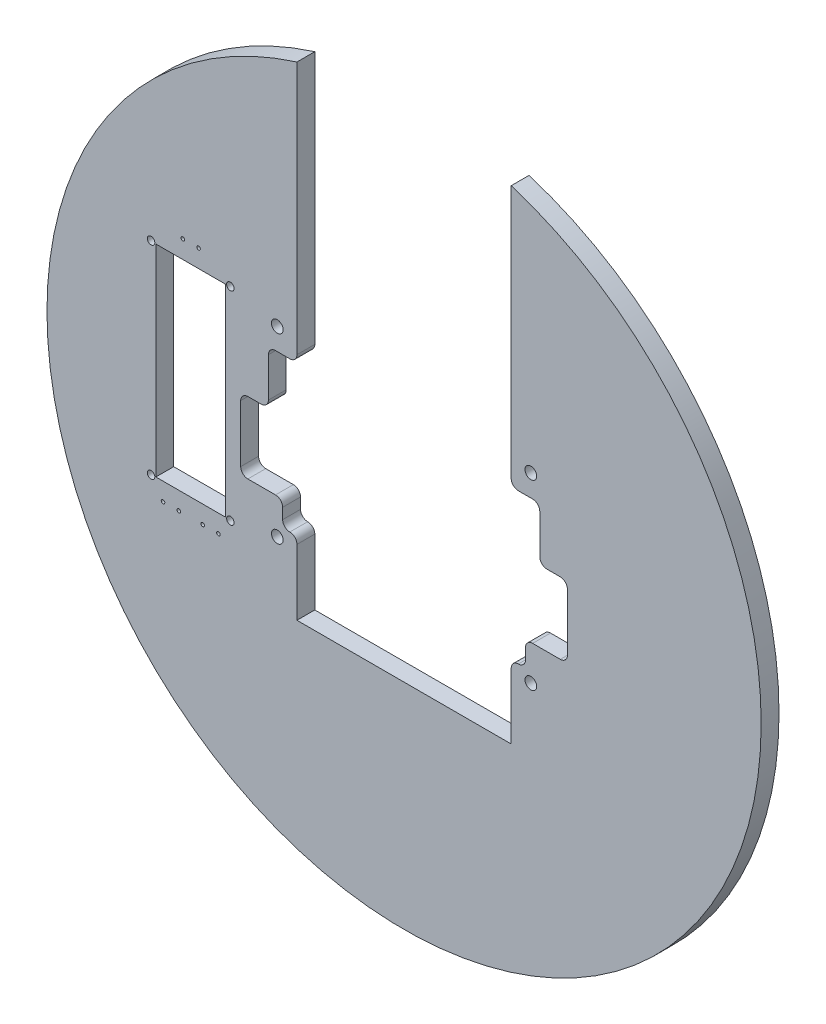
from build123d import *

# Parameters (mm, degrees)
BOSS_EXTRUDE1_DEPTH = 6.35
CUT_EXTRUDE1_REACH  = 210.789
SKETCH2_R           = 1.3335
SKETCH2_W           = 24.765
SKETCH2_H           = 71.755
CUT_EXTRUDE2_REACH  = 210.789
SKETCH3_R           = 0.635
CUT_EXTRUDE3_DEPTH  = 209.788828163
FILLET1_START       = -1
FILLET1_DEPTH       = 8
FILLET1_2_DEPTH     = 6.35
SKETCH5_R           = 2.0828
CUT_EXTRUDE4_DEPTH  = 209.788828163


with BuildPart() as part:
    # Sketch1 → Boss-Extrude1 (new body)
    with BuildSketch(Plane.XY):
        with BuildLine():
            Line((-38.1, 92.71), (-38.1, 165.60027858))
            ThreePointArc((-38.1, 165.60027858), (0, -82.55), (38.1, 165.60027858))
            Line((38.1, 165.60027858), (38.1, 92.71))
            Line((38.1, 92.71), (38.1, -6.35))
            Line((38.1, -6.35), (-38.1, -6.35))
            Line((-38.1, -6.35), (-38.1, 92.71))
        make_face()
    extrude(amount=BOSS_EXTRUDE1_DEPTH)

    # Sketch2 → Cut-Extrude1 (cut, up to next)
    with BuildSketch(Plane(origin=(0, 0, 0), x_dir=(-1, 0, 0), z_dir=(0, 0, -1)), mode=Mode.PRIVATE) as cut_extrude1_sk1:
        with Locations((61.7855, 12.5095)):
            Circle(SKETCH2_R)
    cut_extrude1_tool1 = extrude(cut_extrude1_sk1.sketch, amount=-CUT_EXTRUDE1_REACH, mode=Mode.PRIVATE) & part.part
    # Sketch2 → Cut-Extrude1 (cut, up to next)
    with BuildSketch(Plane(origin=(0, 0, 0), x_dir=(-1, 0, 0), z_dir=(0, 0, -1)), mode=Mode.PRIVATE) as cut_extrude1_sk2:
        with Locations((61.7855, 84.6455)):
            Circle(SKETCH2_R)
    cut_extrude1_tool2 = extrude(cut_extrude1_sk2.sketch, amount=-CUT_EXTRUDE1_REACH, mode=Mode.PRIVATE) & part.part
    # Sketch2 → Cut-Extrude1 (cut, up to next)
    with BuildSketch(Plane(origin=(0, 0, 0), x_dir=(-1, 0, 0), z_dir=(0, 0, -1)), mode=Mode.PRIVATE) as cut_extrude1_sk3:
        with Locations((89.9795, 84.6455)):
            Circle(SKETCH2_R)
    cut_extrude1_tool3 = extrude(cut_extrude1_sk3.sketch, amount=-CUT_EXTRUDE1_REACH, mode=Mode.PRIVATE) & part.part
    # Sketch2 → Cut-Extrude1 (cut, up to next)
    with BuildSketch(Plane(origin=(0, 0, 0), x_dir=(-1, 0, 0), z_dir=(0, 0, -1)), mode=Mode.PRIVATE) as cut_extrude1_sk4:
        with Locations((89.9795, 12.5095)):
            Circle(SKETCH2_R)
    cut_extrude1_tool4 = extrude(cut_extrude1_sk4.sketch, amount=-CUT_EXTRUDE1_REACH, mode=Mode.PRIVATE) & part.part
    # Sketch2 → Cut-Extrude1 (cut, up to next)
    with BuildSketch(Plane(origin=(0, 0, 0), x_dir=(-1, 0, 0), z_dir=(0, 0, -1)), mode=Mode.PRIVATE) as cut_extrude1_sk5:
        with Locations((75.8825, 48.5775)):
            Rectangle(SKETCH2_W, SKETCH2_H)
    cut_extrude1_tool5 = extrude(cut_extrude1_sk5.sketch, amount=-CUT_EXTRUDE1_REACH, mode=Mode.PRIVATE) & part.part
    add(cut_extrude1_tool1.solids().sort_by_distance((-61.7855, 12.5095, 0))[0], mode=Mode.SUBTRACT)
    add(cut_extrude1_tool2.solids().sort_by_distance((-61.7855, 84.6455, 0))[0], mode=Mode.SUBTRACT)
    add(cut_extrude1_tool3.solids().sort_by_distance((-89.9795, 84.6455, 0))[0], mode=Mode.SUBTRACT)
    add(cut_extrude1_tool4.solids().sort_by_distance((-89.9795, 12.5095, 0))[0], mode=Mode.SUBTRACT)
    add(cut_extrude1_tool5.solids().sort_by_distance((-75.8825, 48.5775, 0))[0], mode=Mode.SUBTRACT)

    # Sketch3 → Cut-Extrude2 (cut, up to next)
    with BuildSketch(Plane.XY.offset(6.35), mode=Mode.PRIVATE) as cut_extrude2_sk1:
        with Locations((-66.04, 6.35)):
            Circle(SKETCH3_R)
    cut_extrude2_tool1 = extrude(cut_extrude2_sk1.sketch, amount=-CUT_EXTRUDE2_REACH, mode=Mode.PRIVATE) & part.part
    # Sketch3 → Cut-Extrude2 (cut, up to next)
    with BuildSketch(Plane.XY.offset(6.35), mode=Mode.PRIVATE) as cut_extrude2_sk2:
        with Locations((-71.628, 6.35)):
            Circle(SKETCH3_R)
    cut_extrude2_tool2 = extrude(cut_extrude2_sk2.sketch, amount=-CUT_EXTRUDE2_REACH, mode=Mode.PRIVATE) & part.part
    # Sketch3 → Cut-Extrude2 (cut, up to next)
    with BuildSketch(Plane.XY.offset(6.35), mode=Mode.PRIVATE) as cut_extrude2_sk3:
        with Locations((-80.137, 6.35)):
            Circle(SKETCH3_R)
    cut_extrude2_tool3 = extrude(cut_extrude2_sk3.sketch, amount=-CUT_EXTRUDE2_REACH, mode=Mode.PRIVATE) & part.part
    # Sketch3 → Cut-Extrude2 (cut, up to next)
    with BuildSketch(Plane.XY.offset(6.35), mode=Mode.PRIVATE) as cut_extrude2_sk4:
        with Locations((-85.725, 6.35)):
            Circle(SKETCH3_R)
    cut_extrude2_tool4 = extrude(cut_extrude2_sk4.sketch, amount=-CUT_EXTRUDE2_REACH, mode=Mode.PRIVATE) & part.part
    # Sketch3 → Cut-Extrude2 (cut, up to next)
    with BuildSketch(Plane.XY.offset(6.35), mode=Mode.PRIVATE) as cut_extrude2_sk5:
        with Locations((-73.0885, 90.805)):
            Circle(SKETCH3_R)
    cut_extrude2_tool5 = extrude(cut_extrude2_sk5.sketch, amount=-CUT_EXTRUDE2_REACH, mode=Mode.PRIVATE) & part.part
    # Sketch3 → Cut-Extrude2 (cut, up to next)
    with BuildSketch(Plane.XY.offset(6.35), mode=Mode.PRIVATE) as cut_extrude2_sk6:
        with Locations((-78.6765, 90.805)):
            Circle(SKETCH3_R)
    cut_extrude2_tool6 = extrude(cut_extrude2_sk6.sketch, amount=-CUT_EXTRUDE2_REACH, mode=Mode.PRIVATE) & part.part
    add(cut_extrude2_tool1.solids().sort_by_distance((-66.04, 6.35, 6.35))[0], mode=Mode.SUBTRACT)
    add(cut_extrude2_tool2.solids().sort_by_distance((-71.628, 6.35, 6.35))[0], mode=Mode.SUBTRACT)
    add(cut_extrude2_tool3.solids().sort_by_distance((-80.137, 6.35, 6.35))[0], mode=Mode.SUBTRACT)
    add(cut_extrude2_tool4.solids().sort_by_distance((-85.725, 6.35, 6.35))[0], mode=Mode.SUBTRACT)
    add(cut_extrude2_tool5.solids().sort_by_distance((-73.0885, 90.805, 6.35))[0], mode=Mode.SUBTRACT)
    add(cut_extrude2_tool6.solids().sort_by_distance((-78.6765, 90.805, 6.35))[0], mode=Mode.SUBTRACT)

    # Sketch4 → Cut-Extrude3 (cut, through all)
    with BuildSketch(Plane.XY.offset(6.35)):
        Polygon((-48.26, 72.898), (-48.26, 53.848), (-58.1, 53.848), (-58.1, 28.448), (-43.18, 28.448), (-43.18, 19.558), (-38.1, 19.558), (-38.1, 72.898), align=None)
        Polygon((43.18, 28.448), (58.1, 28.448), (58.1, 53.848), (48.26, 53.848), (48.26, 72.898), (38.1, 72.898), (38.1, 19.558), (43.18, 19.558), align=None)
    extrude(amount=-CUT_EXTRUDE3_DEPTH, mode=Mode.SUBTRACT)

    # Fillet1: read off the stored shape, not the designer's step
    # Fillet1 outline → Fillet1 (cut)
    with BuildSketch(Plane.XY.offset(FILLET1_START)):
        with BuildLine():
            Line((38.1, 72.898), (40.64, 72.898))
            ThreePointArc((40.64, 72.898), (38.843948776, 73.641948776), (38.1, 75.438))
            Line((38.1, 75.438), (38.1, 72.898))
        make_face()
        with BuildLine():
            Line((48.26, 53.848), (50.8, 53.848))
            ThreePointArc((50.8, 53.848), (49.003948776, 54.591948776), (48.26, 56.388))
            Line((48.26, 56.388), (48.26, 53.848))
        make_face()
        with BuildLine():
            Line((43.18, 28.448), (43.18, 25.908))
            ThreePointArc((43.18, 25.908), (43.923948776, 27.704051224), (45.72, 28.448))
            Line((45.72, 28.448), (43.18, 28.448))
        make_face()
        with BuildLine():
            ThreePointArc((38.1, 17.018), (38.843948776, 18.814051224), (40.64, 19.558))
            Line((40.64, 19.558), (38.1, 19.558))
            Line((38.1, 19.558), (38.1, 17.018))
        make_face()
        with BuildLine():
            Line((-38.1, 19.558), (-40.64, 19.558))
            ThreePointArc((-40.64, 19.558), (-38.843948776, 18.814051224), (-38.1, 17.018))
            Line((-38.1, 17.018), (-38.1, 19.558))
        make_face()
        with BuildLine():
            ThreePointArc((-38.1, 75.438), (-38.843948776, 73.641948776), (-40.64, 72.898))
            Line((-40.64, 72.898), (-38.1, 72.898))
            Line((-38.1, 72.898), (-38.1, 75.438))
        make_face()
        with BuildLine():
            ThreePointArc((-48.26, 56.388), (-49.003948776, 54.591948776), (-50.8, 53.848))
            Line((-50.8, 53.848), (-48.26, 53.848))
            Line((-48.26, 53.848), (-48.26, 56.388))
        make_face()
        with BuildLine():
            ThreePointArc((-45.72, 28.448), (-43.923948776, 27.704051224), (-43.18, 25.908))
            Line((-43.18, 25.908), (-43.18, 28.448))
            Line((-43.18, 28.448), (-45.72, 28.448))
        make_face()
    extrude(amount=FILLET1_DEPTH, mode=Mode.SUBTRACT)

    # Fillet1 2 outline → Fillet1 2 (add)
    with BuildSketch(Plane.XY):
        with BuildLine():
            Line((43.18, 19.558), (43.18, 22.098))
            ThreePointArc((43.18, 22.098), (42.436051224, 20.301948776), (40.64, 19.558))
            Line((40.64, 19.558), (43.18, 19.558))
        make_face()
        with BuildLine():
            ThreePointArc((45.72, 72.898), (47.516051224, 72.154051224), (48.26, 70.358))
            Line((48.26, 70.358), (48.26, 72.898))
            Line((48.26, 72.898), (45.72, 72.898))
        make_face()
        with BuildLine():
            ThreePointArc((55.56, 53.848), (57.356051224, 53.104051224), (58.1, 51.308))
            Line((58.1, 51.308), (58.1, 53.848))
            Line((58.1, 53.848), (55.56, 53.848))
        make_face()
        with BuildLine():
            ThreePointArc((58.1, 30.988), (57.356051224, 29.191948776), (55.56, 28.448))
            Line((55.56, 28.448), (58.1, 28.448))
            Line((58.1, 28.448), (58.1, 30.988))
        make_face()
        with BuildLine():
            Line((-43.18, 19.558), (-40.64, 19.558))
            ThreePointArc((-40.64, 19.558), (-42.436051224, 20.301948776), (-43.18, 22.098))
            Line((-43.18, 22.098), (-43.18, 19.558))
        make_face()
        with BuildLine():
            Line((-48.26, 72.898), (-48.26, 70.358))
            ThreePointArc((-48.26, 70.358), (-47.516051224, 72.154051224), (-45.72, 72.898))
            Line((-45.72, 72.898), (-48.26, 72.898))
        make_face()
        with BuildLine():
            Line((-58.1, 53.848), (-58.1, 51.308))
            ThreePointArc((-58.1, 51.308), (-57.356051224, 53.104051224), (-55.56, 53.848))
            Line((-55.56, 53.848), (-58.1, 53.848))
        make_face()
        with BuildLine():
            Line((-58.1, 28.448), (-55.56, 28.448))
            ThreePointArc((-55.56, 28.448), (-57.356051224, 29.191948776), (-58.1, 30.988))
            Line((-58.1, 30.988), (-58.1, 28.448))
        make_face()
    extrude(amount=FILLET1_2_DEPTH)

    # Sketch5 → Cut-Extrude4 (cut, through all)
    with BuildSketch(Plane.XY.offset(6.35)):
        with Locations((-45.085, 80.645)):
            Circle(SKETCH5_R)
        with Locations(Location((45.085, 80.645, 0), (0, 0, 180))):
            Circle(SKETCH5_R)
        with Locations((45.085, 15.875)):
            Circle(SKETCH5_R)
        with Locations(Location((-45.085, 15.875, 0), (0, 0, 180))):
            Circle(SKETCH5_R)
    extrude(amount=-CUT_EXTRUDE4_DEPTH, mode=Mode.SUBTRACT)


solid = part.part
